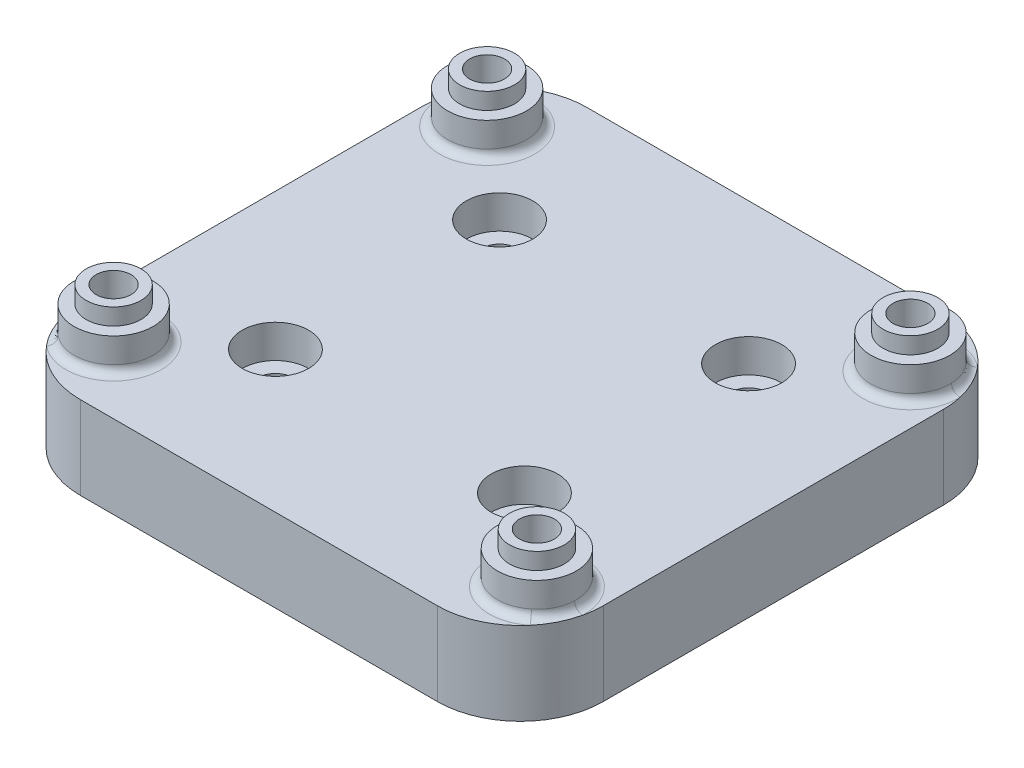
from build123d import *

# Parameters (mm, degrees)
ESQUISSE1_W             = 63
ESQUISSE1_H             = 61
BOSS_EXTRU_1_DEPTH      = 10
ESQUISSE4_R             = 4.75
BOSS_EXTRU_3_DEPTH      = 4
ESQUISSE5_R             = 3.3
BOSS_EXTRU_4_DEPTH      = 2
ESQUISSE6_R             = 2.1
ENL_V_MAT_EXTRU_2_DEPTH = 90.140338792
CONG_1_R                = 10
CONG_2_R                = 1
ESQUISSE7_R             = 2.1
ENL_V_MAT_EXTRU_3_DEPTH = 90.140338931
ESQUISSE8_R             = 4
ENL_V_MAT_EXTRU_4_DEPTH = 4
ESQUISSE9_R             = 4
ENL_V_MAT_EXTRU_5_DEPTH = 4.5


with BuildPart() as part:
    # Esquisse1 → Boss.-Extru.1 (new body)
    with BuildSketch(Plane(origin=(0, 0, 0), x_dir=(1, 0, 0), z_dir=(0, 1, 0))):
        with Locations((31.5, 30.5)):
            Rectangle(ESQUISSE1_W, ESQUISSE1_H)
    extrude(amount=BOSS_EXTRU_1_DEPTH)

    # Esquisse4 → Boss.-Extru.3 (add)
    with BuildSketch(Plane(origin=(0, 10, 0), x_dir=(1, 0, 0), z_dir=(0, 1, 0))):
        with Locations((6, 8)):
            Circle(ESQUISSE4_R)
        with Locations((6, 53)):
            Circle(ESQUISSE4_R)
        with Locations((57, 8)):
            Circle(ESQUISSE4_R)
        with Locations((57, 53)):
            Circle(ESQUISSE4_R)
    extrude(amount=BOSS_EXTRU_3_DEPTH)

    # Esquisse5 → Boss.-Extru.4 (add)
    with BuildSketch(Plane(origin=(0, 14, 0), x_dir=(1, 0, 0), z_dir=(0, 1, 0))):
        with Locations((57, 53)):
            Circle(ESQUISSE5_R)
        with Locations((57, 8)):
            Circle(ESQUISSE5_R)
        with Locations((6, 8)):
            Circle(ESQUISSE5_R)
        with Locations((6, 53)):
            Circle(ESQUISSE5_R)
    extrude(amount=BOSS_EXTRU_4_DEPTH)

    # Esquisse6 → Enlèv. mat.-Extru.2 (cut, through all)
    with BuildSketch(Plane(origin=(0, 16, 0), x_dir=(1, 0, 0), z_dir=(0, 1, 0))):
        with Locations((6, 8)):
            Circle(ESQUISSE6_R)
        with Locations((6, 53)):
            Circle(ESQUISSE6_R)
        with Locations((57, 53)):
            Circle(ESQUISSE6_R)
        with Locations((57, 8)):
            Circle(ESQUISSE6_R)
    extrude(amount=-ENL_V_MAT_EXTRU_2_DEPTH, mode=Mode.SUBTRACT)

    # Congé1
    cong_1_edges = [part.edges().sort_by_distance(p)[0] for p in [
        (0, 5, 0),
        (0, 5, -61),
        (63, 5, -61),
        (63, 5, 0),
    ]]
    fillet(cong_1_edges, radius=CONG_1_R)

    # Congé2
    cong_2_edges = [part.edges().sort_by_distance(p)[0] for p in [
        (52.25, 10, -53),
        (1.25, 10, -53),
        (1.25, 10, -8),
        (52.25, 10, -8),
    ]]
    fillet(cong_2_edges, radius=CONG_2_R)

    # Esquisse7 → Enlèv. mat.-Extru.3 (cut, through all)
    with BuildSketch(Plane(origin=(0, 0, 0), x_dir=(-1, 0, 0), z_dir=(0, -1, 0))):
        with Locations((-16.5, 17)):
            Circle(ESQUISSE7_R)
        with Locations((-46.5, 17)):
            Circle(ESQUISSE7_R)
        with Locations((-16.5, 44)):
            Circle(ESQUISSE7_R)
        with Locations((-46.5, 44)):
            Circle(ESQUISSE7_R)
    extrude(amount=-ENL_V_MAT_EXTRU_3_DEPTH, mode=Mode.SUBTRACT)

    # Esquisse8 → Enlèv. mat.-Extru.4 (cut)
    with BuildSketch(Plane(origin=(0, 10, 0), x_dir=(1, 0, 0), z_dir=(0, 1, 0))):
        with Locations((16.5, 44)):
            Circle(ESQUISSE8_R)
        with Locations((46.5, 44)):
            Circle(ESQUISSE8_R)
        with Locations((46.5, 17)):
            Circle(ESQUISSE8_R)
        with Locations((16.5, 17)):
            Circle(ESQUISSE8_R)
    extrude(amount=-ENL_V_MAT_EXTRU_4_DEPTH, mode=Mode.SUBTRACT)

    # Esquisse9 → Enlèv. mat.-Extru.5 (cut)
    with BuildSketch(Plane(origin=(0, 0, 0), x_dir=(-1, 0, 0), z_dir=(0, -1, 0))):
        with Locations((-57, 8)):
            Circle(ESQUISSE9_R)
        with Locations((-57, 53)):
            Circle(ESQUISSE9_R)
        with Locations((-6, 53)):
            Circle(ESQUISSE9_R)
        with Locations((-6, 8)):
            Circle(ESQUISSE9_R)
    extrude(amount=-ENL_V_MAT_EXTRU_5_DEPTH, mode=Mode.SUBTRACT)


solid = part.part
